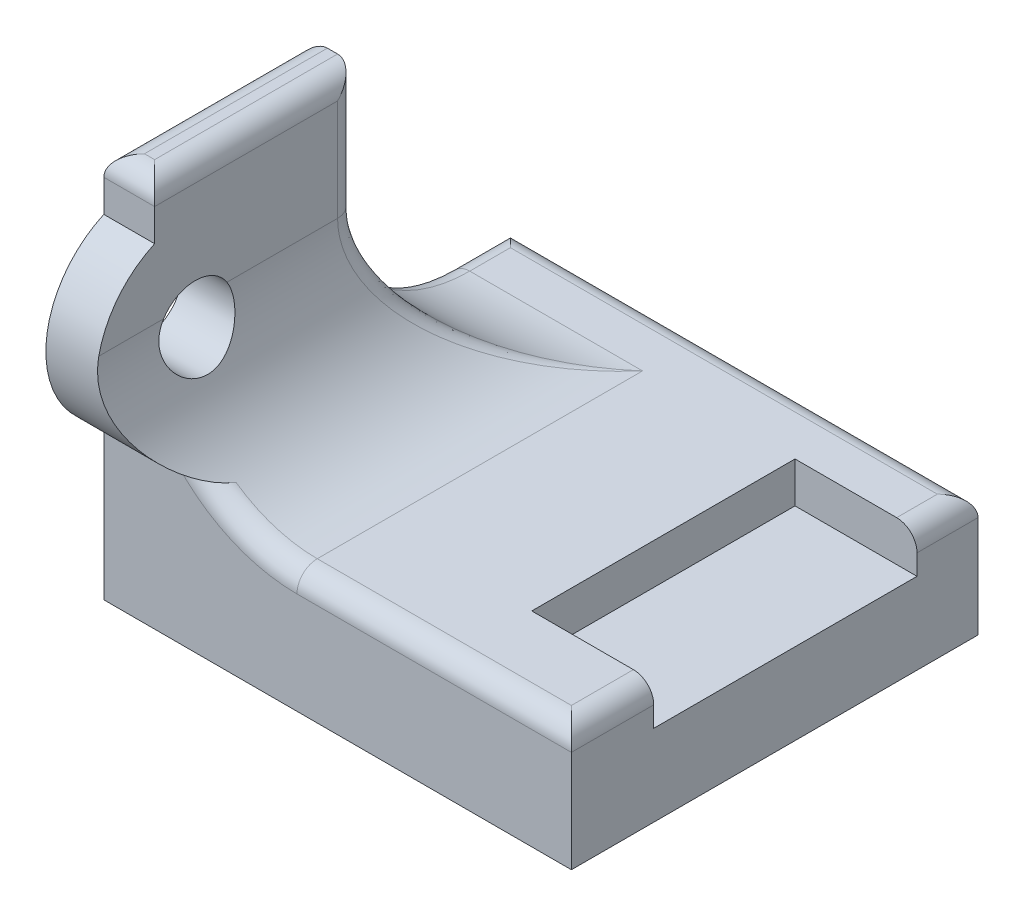
from build123d import *

# Parameters (mm, degrees)
CROQUIS1_W              = 23
CROQUIS1_H              = 20
SALIENTE_EXTRUIR1_DEPTH = 9
CROQUIS2_W              = 6
CROQUIS2_H              = 12.95
CORTAR_EXTRUIR1_DEPTH   = 2
CROQUIS3_W              = 2.5
CROQUIS3_H              = 20
SALIENTE_EXTRUIR3_DEPTH = 15
CROQUIS4_R              = 1.85
CORTAR_EXTRUIR4_DEPTH   = 2.5
SALIENTE_EXTRUIR7_DEPTH = 2.5
CROQUIS7_W              = 10
CROQUIS7_H              = 15
CORTAR_EXTRUIR5_DEPTH   = 2.5
CROQUIS8_W              = 23
CROQUIS8_H              = 20
CORTAR_EXTRUIR6_DEPTH   = 3
CROQUIS9_W              = 2.5
CROQUIS9_H              = 10
CORTAR_EXTRUIR7_DEPTH   = 2
REDONDEO1_R             = 7
REDONDEO2_R             = 1


with BuildPart() as part:
    # Croquis1 → Saliente-Extruir1 (new body)
    with BuildSketch(Plane(origin=(0, 0, 0), x_dir=(1, 0, 0), z_dir=(0, 1, 0))):
        with Locations((11.5, -10)):
            Rectangle(CROQUIS1_W, CROQUIS1_H)
    extrude(amount=SALIENTE_EXTRUIR1_DEPTH)

    # Croquis2 → Cortar-Extruir1 (cut)
    with BuildSketch(Plane(origin=(0, 9, 0), x_dir=(1, 0, 0), z_dir=(0, 1, 0))):
        with Locations((20, -9.475)):
            Rectangle(CROQUIS2_W, CROQUIS2_H)
    extrude(amount=-CORTAR_EXTRUIR1_DEPTH, mode=Mode.SUBTRACT)

    # Croquis3 → Saliente-Extruir3 (add)
    with BuildSketch(Plane(origin=(0, 9, 0), x_dir=(1, 0, 0), z_dir=(0, 1, 0))):
        with Locations((1.25, -10)):
            Rectangle(CROQUIS3_W, CROQUIS3_H)
    extrude(amount=SALIENTE_EXTRUIR3_DEPTH)

    # Croquis4 → Cortar-Extruir4 (cut)
    with BuildSketch(Plane(origin=(2.5, 0, 0), x_dir=(0, 0, -1), z_dir=(1, 0, 0))):
        with Locations((-18, 15)):
            Circle(CROQUIS4_R)
    extrude(amount=-CORTAR_EXTRUIR4_DEPTH, mode=Mode.SUBTRACT)

    # Croquis6 → Saliente-Extruir7 (add)
    with BuildSketch(Plane(origin=(2.5, 0, 0), x_dir=(0, 0, -1), z_dir=(1, 0, 0))):
        with BuildLine():
            Line((-20, 19.418427322), (-20, 10.581572678))
            ThreePointArc((-20, 10.581572678), (-22.85, 15), (-20, 19.418427322))
        make_face()
    extrude(amount=-SALIENTE_EXTRUIR7_DEPTH)

    # Croquis7 → Cortar-Extruir5 (cut)
    with BuildSketch(Plane(origin=(2.5, 0, 0), x_dir=(0, 0, -1), z_dir=(1, 0, 0))):
        with Locations((-5, 16.5)):
            Rectangle(CROQUIS7_W, CROQUIS7_H)
    extrude(amount=-CORTAR_EXTRUIR5_DEPTH, mode=Mode.SUBTRACT)

    # Croquis8 → Cortar-Extruir6 (cut)
    with BuildSketch(Plane.XZ):
        with Locations((11.5, 10)):
            Rectangle(CROQUIS8_W, CROQUIS8_H)
    extrude(amount=-CORTAR_EXTRUIR6_DEPTH, mode=Mode.SUBTRACT)

    # Croquis9 → Cortar-Extruir7 (cut)
    with BuildSketch(Plane(origin=(0, 24, 0), x_dir=(1, 0, 0), z_dir=(0, 1, 0))):
        with Locations((1.25, -15)):
            Rectangle(CROQUIS9_W, CROQUIS9_H)
    extrude(amount=-CORTAR_EXTRUIR7_DEPTH, mode=Mode.SUBTRACT)

    # Redondeo1
    # the kernel refuses this fillet: 7 mm, written as the material it adds along each edge
    with BuildSketch(Plane(origin=(2.5, 9, 10), x_dir=(0, 0, -1), z_dir=(-1, 0, 0))) as redondeo1_piece_1:
        with BuildLine():
            CenterArc((REDONDEO1_R, -REDONDEO1_R), REDONDEO1_R, 90, 90)
            Line((0, -REDONDEO1_R), (0, 0))
            Line((0, 0), (REDONDEO1_R, 0))
        make_face()
    extrude(amount=2.5)
    with BuildSketch(Plane(origin=(2.5, 9, 10), x_dir=(1, 0, 0), z_dir=(0, 0, 1))) as redondeo1_piece_2_section:
        with BuildLine():
            CenterArc((REDONDEO1_R, REDONDEO1_R), REDONDEO1_R, 180, 90)
            Line((0, REDONDEO1_R), (0, 0))
            Line((0, 0), (REDONDEO1_R, 0))
        make_face()
    redondeo1_piece_2 = extrude(amount=10, mode=Mode.PRIVATE)
    redondeo1_piece_2 = redondeo1_piece_2 - Plane(origin=(2.5, 15, 18), x_dir=(0, 0, -1), z_dir=(1, 0, 0)) * Cylinder(1.85, 48, mode=Mode.PRIVATE)
    add(redondeo1_piece_2)
    with BuildSketch(Plane(origin=(2.5, 9, -7.5), x_dir=(1, 0, 0), z_dir=(0, 0, 1))) as redondeo1_piece_3_section:
        with BuildLine():
            CenterArc((REDONDEO1_R, REDONDEO1_R), REDONDEO1_R, 180, 90)
            Line((0, REDONDEO1_R), (0, 0))
            Line((0, 0), (REDONDEO1_R, 0))
        make_face()
    redondeo1_piece_3 = extrude(amount=45, mode=Mode.PRIVATE)
    redondeo1_piece_3 = split(redondeo1_piece_3, bisect_by=Plane(origin=(2.5, 9, 20), z_dir=(0, 0, 1)), keep=Keep.TOP, mode=Mode.PRIVATE)
    redondeo1_piece_3 = redondeo1_piece_3 & Plane(origin=(2.5, 15, 18), x_dir=(0, -0.9110159426851695, 0.4123711340206198), z_dir=(1, 0, 0)) * Cylinder(4.85, 118, mode=Mode.PRIVATE)
    add(redondeo1_piece_3)
    with BuildSketch(Plane(origin=(2.5, 9, -7.5), x_dir=(1, 0, 0), z_dir=(0, 0, 1))) as redondeo1_piece_4a_section:
        with BuildLine():
            CenterArc((REDONDEO1_R, REDONDEO1_R), REDONDEO1_R, 180, 90)
            Line((0, REDONDEO1_R), (0, 0))
            Line((0, 0), (REDONDEO1_R, 0))
        make_face()
    redondeo1_piece_4a = extrude(amount=27.5, mode=Mode.PRIVATE)
    redondeo1_piece_4a = split(redondeo1_piece_4a, bisect_by=Plane(origin=(2.5, 9, 0), z_dir=(0, 0, 1)), keep=Keep.TOP, mode=Mode.PRIVATE)
    redondeo1_piece_4a = split(redondeo1_piece_4a, bisect_by=Plane(origin=(2.5, 9, 10), z_dir=(0, 0, -1)), keep=Keep.TOP, mode=Mode.PRIVATE)
    with BuildSketch(Plane(origin=(20, 9, 10), x_dir=(0, 0, -1), z_dir=(-1, 0, 0))) as redondeo1_piece_4b_section:
        with BuildLine():
            CenterArc((REDONDEO1_R, -REDONDEO1_R), REDONDEO1_R, 90, 90)
            Line((0, -REDONDEO1_R), (0, 0))
            Line((0, 0), (REDONDEO1_R, 0))
        make_face()
    redondeo1_piece_4b = extrude(amount=20, mode=Mode.PRIVATE)
    redondeo1_piece_4b = split(redondeo1_piece_4b, bisect_by=Plane(origin=(2.5, 9, 10), z_dir=(1, 0, 0)), keep=Keep.TOP, mode=Mode.PRIVATE)
    redondeo1_piece_4b = split(redondeo1_piece_4b, bisect_by=Plane(origin=(17, 9, 10), z_dir=(-1, 0, 0)), keep=Keep.TOP, mode=Mode.PRIVATE)
    redondeo1_piece_4 = redondeo1_piece_4a & redondeo1_piece_4b
    add(redondeo1_piece_4)

    # Redondeo2
    redondeo2_edges = [part.edges().sort_by_distance(p)[0] for p in [
        (4.977657648, 10.656927883, 7.522342352),
        (0, 19, 10),
        (0, 11.050252532, 7.949747468),
        (7.147234739, 9.40723915, 20),
        (1.25, 22, 20),
        (0, 22, 15),
        (2.5, 22, 15),
        (2.5, 19, 10),
        (23, 9, 1.5),
        (23, 9, 17.975),
        (11.5, 9, 0),
        (0, 9, 1.5),
        (16.25, 9, 20),
    ]]
    fillet(redondeo2_edges, radius=REDONDEO2_R)


solid = part.part
